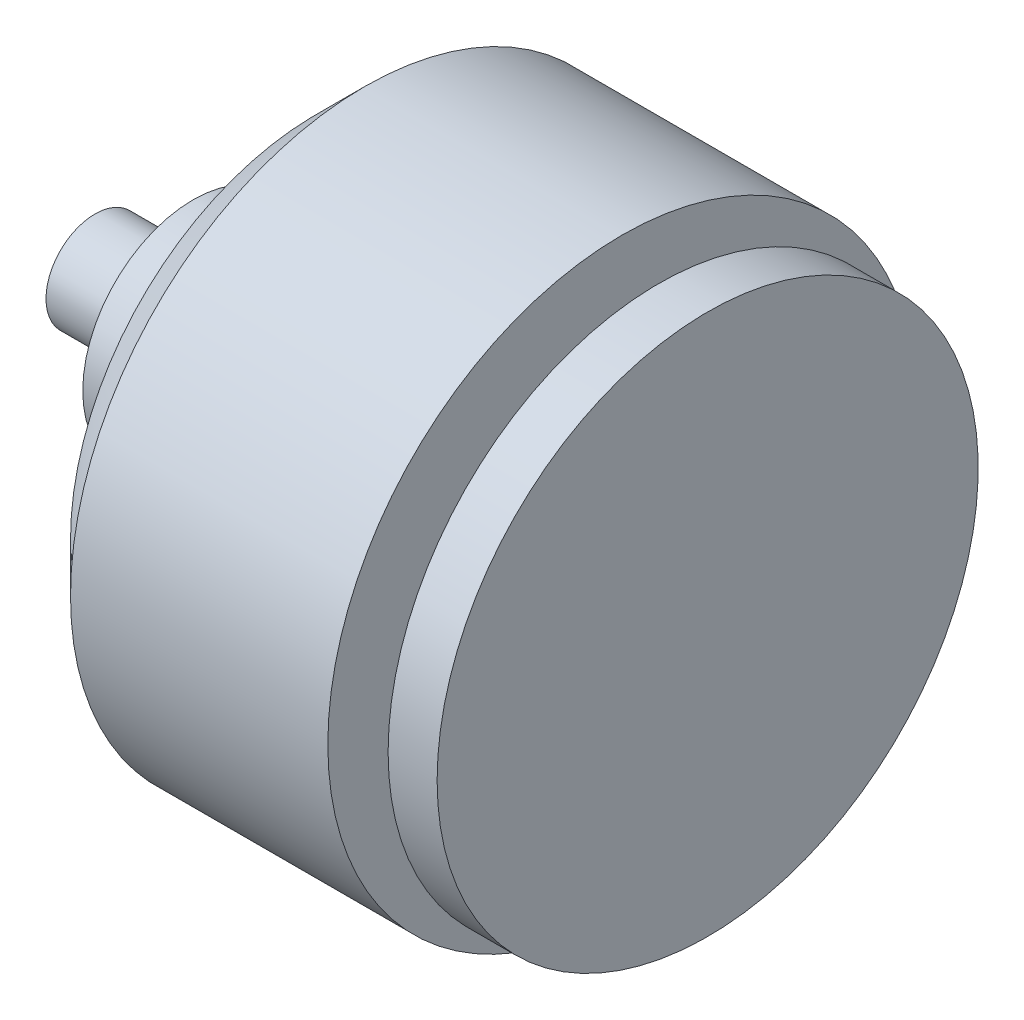
from build123d import *


with BuildPart() as part:
    # Sketch1 → Revolve1 (revolve)
    with BuildSketch(Plane.XY):
        Polygon((0, 0), (0, 22.08), (-4, 22.08), (-4, 16.8), (-7, 16.8), (-7, 24), (-28, 24), (-32, 20), (-32, 9), (-42, 9), (-42, 4), (-50, 4), (-50, 0), align=None)
    revolve(axis=Axis((-10, 0, 0), (1, 0, 0)))


solid = part.part
